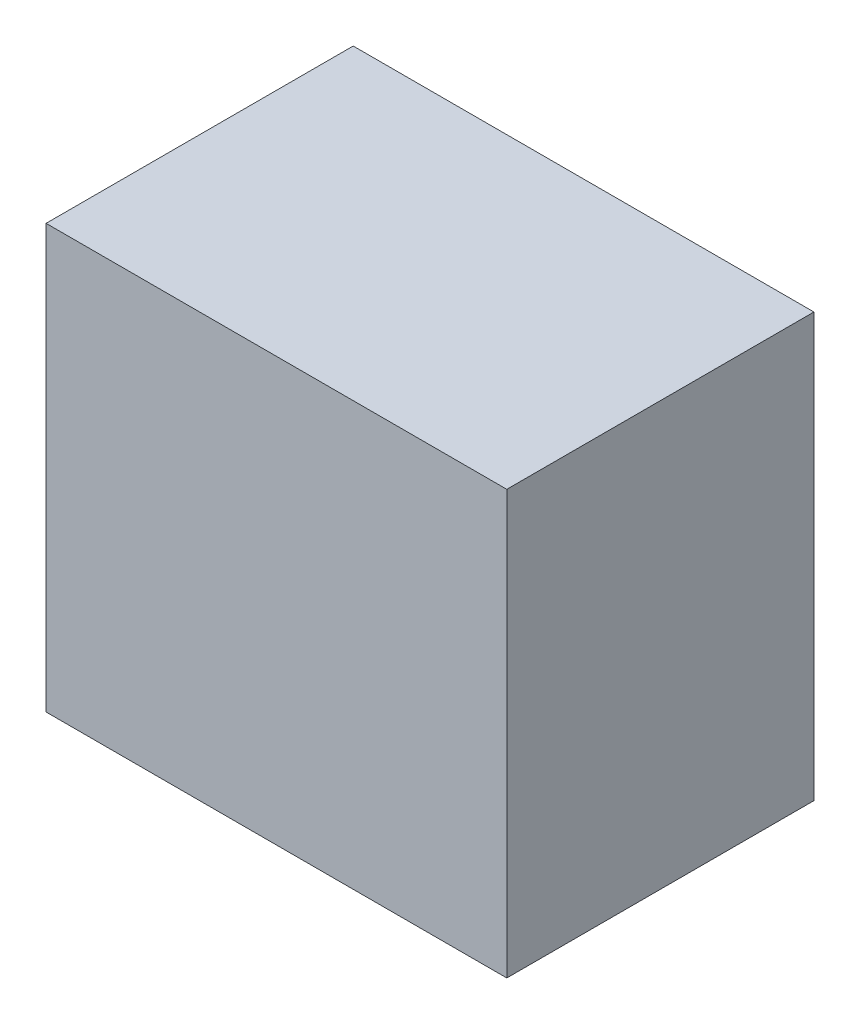
from build123d import *

# Parameters (mm, degrees)
SKETCH1_W           = 76.2
SKETCH1_H           = 50.8
BOSS_EXTRUDE1_DEPTH = 70


with BuildPart() as part:
    # Sketch1 → Boss-Extrude1 (new body)
    with BuildSketch(Plane(origin=(0, 0, 0), x_dir=(1, 0, 0), z_dir=(0, 1, 0))):
        with Locations((38.1, 25.4)):
            Rectangle(SKETCH1_W, SKETCH1_H)
    extrude(amount=BOSS_EXTRUDE1_DEPTH)


solid = part.part
